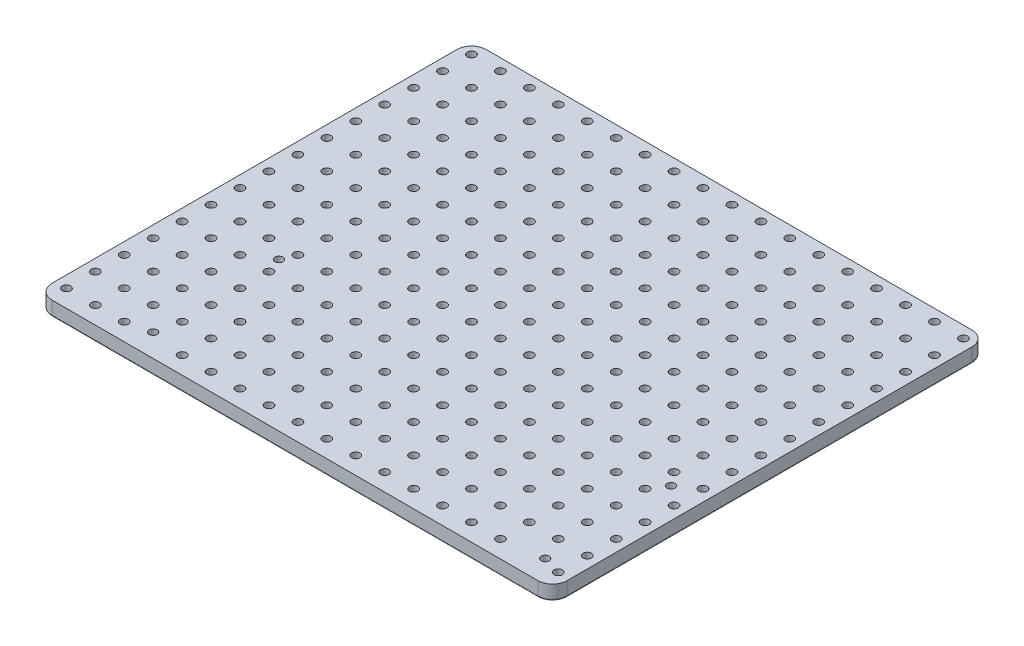
from build123d import *

# Parameters (mm, degrees)
SKETCH1_W            = 178
SKETCH1_H            = 150
BOSS_EXTRUDE1_DEPTH  = 5
SKETCH2_R            = 1.45
CUT_EXTRUDE1_DEPTH   = 233.828262889
LPATTERN1_COUNT      = 18
LPATTERN1_PITCH      = 10
LPATTERN1_COUNT_DIR2 = 15
LPATTERN1_PITCH_DIR2 = 10
SKETCH3_R            = 1.4
CUT_EXTRUDE2_DEPTH   = 233.828262889
FILLET1_R            = 5
FILLET2_R            = 0.5


with BuildPart() as part:
    # Sketch1 → Boss-Extrude1 (new body)
    with BuildSketch(Plane(origin=(0, 0, 0), x_dir=(1, 0, 0), z_dir=(0, 1, 0))):
        with Locations((89, 75)):
            Rectangle(SKETCH1_W, SKETCH1_H)
    extrude(amount=BOSS_EXTRUDE1_DEPTH)

    # Sketch2 → Cut-Extrude1 (cut, through all)
    with BuildSketch(Plane(origin=(0, 5, 0), x_dir=(1, 0, 0), z_dir=(0, 1, 0))):
        with Locations(Location((4, 146, 0), (0, 0, 270))):
            Circle(SKETCH2_R)
    cut_extrude1 = extrude(amount=-CUT_EXTRUDE1_DEPTH, mode=Mode.SUBTRACT)

    # LPattern1: Cut-Extrude1 18 × 15, 2 skipped
    with Locations(*[(i * LPATTERN1_PITCH, 0, j * LPATTERN1_PITCH_DIR2) for i in range(LPATTERN1_COUNT) for j in range(LPATTERN1_COUNT_DIR2) if (i, j) not in ((0, 0), (3, 14), (16, 14))]):
        add(cut_extrude1, mode=Mode.SUBTRACT)

    # Sketch3 → Cut-Extrude2 (cut, through all)
    with BuildSketch(Plane.XZ):
        with Locations(Location((32.088462575, -7.87577331, 0), (0, 0, 270))):
            Circle(SKETCH3_R)
        with Locations(Location((32.088462575, -51.37577267, 0), (0, 0, 270))):
            Circle(SKETCH3_R)
        with Locations(Location((167.588463355, -51.37577267, 0), (0, 0, 270))):
            Circle(SKETCH3_R)
        with Locations(Location((167.588463355, -7.87577331, 0), (0, 0, 270))):
            Circle(SKETCH3_R)
    extrude(amount=-CUT_EXTRUDE2_DEPTH, mode=Mode.SUBTRACT)

    # Fillet1
    fillet1_edges = [part.edges().sort_by_distance(p)[0] for p in [
        (0, 2.5, -150),
        (178, 2.5, -150),
        (178, 2.5, 0),
        (0, 2.5, 0),
    ]]
    fillet(fillet1_edges, radius=FILLET1_R)

    # Fillet2
    fillet2_edges = [part.edges().sort_by_distance(p)[0] for p in [
        (14, 0, -127.45),
        (24, 0, -127.45),
        (34, 0, -127.45),
        (44, 0, -127.45),
        (54, 0, -127.45),
        (64, 0, -127.45),
        (74, 0, -127.45),
        (84, 0, -127.45),
        (94, 0, -127.45),
        (104, 0, -127.45),
        (114, 0, -127.45),
        (124, 0, -127.45),
        (134, 0, -127.45),
        (144, 0, -127.45),
        (154, 0, -127.45),
        (164, 0, -127.45),
        (174, 0, -127.45),
        (4, 0, -117.45),
        (14, 0, -117.45),
        (24, 0, -117.45),
        (34, 0, -117.45),
        (44, 0, -117.45),
        (54, 0, -117.45),
        (64, 0, -117.45),
        (74, 0, -117.45),
        (84, 0, -117.45),
        (94, 0, -117.45),
        (104, 0, -117.45),
        (4, 0, -147.45),
        (114, 0, -117.45),
        (124, 0, -117.45),
        (134, 0, -117.45),
        (144, 0, -117.45),
        (154, 0, -117.45),
        (164, 0, -117.45),
        (174, 0, -117.45),
        (4, 0, -107.45),
        (14, 0, -107.45),
        (24, 0, -107.45),
        (34, 0, -107.45),
        (44, 0, -107.45),
        (54, 0, -107.45),
        (64, 0, -107.45),
        (74, 0, -107.45),
        (84, 0, -107.45),
        (94, 0, -107.45),
        (104, 0, -107.45),
        (114, 0, -107.45),
        (124, 0, -107.45),
        (134, 0, -107.45),
        (144, 0, -107.45),
        (154, 0, -107.45),
        (164, 0, -107.45),
        (174, 0, -107.45),
        (14, 0, -147.45),
        (4, 0, -97.45),
        (14, 0, -97.45),
        (24, 0, -97.45),
        (34, 0, -97.45),
        (44, 0, -97.45),
        (54, 0, -97.45),
        (64, 0, -97.45),
        (74, 0, -97.45),
        (84, 0, -97.45),
        (94, 0, -97.45),
        (104, 0, -97.45),
        (114, 0, -97.45),
        (124, 0, -97.45),
        (24, 0, -147.45),
        (134, 0, -97.45),
        (144, 0, -97.45),
        (154, 0, -97.45),
        (164, 0, -97.45),
        (174, 0, -97.45),
        (4, 0, -87.45),
        (14, 0, -87.45),
        (24, 0, -87.45),
        (34, 0, -87.45),
        (44, 0, -87.45),
        (34, 0, -147.45),
        (54, 0, -87.45),
        (64, 0, -87.45),
        (74, 0, -87.45),
        (84, 0, -87.45),
        (94, 0, -87.45),
        (104, 0, -87.45),
        (114, 0, -87.45),
        (124, 0, -87.45),
        (134, 0, -87.45),
        (144, 0, -87.45),
        (44, 0, -147.45),
        (154, 0, -87.45),
        (164, 0, -87.45),
        (174, 0, -87.45),
        (4, 0, -77.45),
        (14, 0, -77.45),
        (24, 0, -77.45),
        (34, 0, -77.45),
        (44, 0, -77.45),
        (54, 0, -77.45),
        (64, 0, -77.45),
        (54, 0, -147.45),
        (74, 0, -77.45),
        (84, 0, -77.45),
        (94, 0, -77.45),
        (104, 0, -77.45),
        (114, 0, -77.45),
        (124, 0, -77.45),
        (134, 0, -77.45),
        (144, 0, -77.45),
        (154, 0, -77.45),
        (164, 0, -77.45),
        (64, 0, -147.45),
        (174, 0, -77.45),
        (4, 0, -67.45),
        (14, 0, -67.45),
        (24, 0, -67.45),
        (34, 0, -67.45),
        (44, 0, -67.45),
        (54, 0, -67.45),
        (64, 0, -67.45),
        (74, 0, -67.45),
        (84, 0, -67.45),
        (74, 0, -147.45),
        (94, 0, -67.45),
        (104, 0, -67.45),
        (114, 0, -67.45),
        (124, 0, -67.45),
        (134, 0, -67.45),
        (144, 0, -67.45),
        (154, 0, -67.45),
        (164, 0, -67.45),
        (174, 0, -67.45),
        (4, 0, -57.45),
        (84, 0, -147.45),
        (14, 0, -57.45),
        (24, 0, -57.45),
        (34, 0, -57.45),
        (44, 0, -57.45),
        (54, 0, -57.45),
        (64, 0, -57.45),
        (74, 0, -57.45),
        (84, 0, -57.45),
        (94, 0, -57.45),
        (104, 0, -57.45),
        (94, 0, -147.45),
        (114, 0, -57.45),
        (124, 0, -57.45),
        (134, 0, -57.45),
        (144, 0, -57.45),
        (154, 0, -57.45),
        (164, 0, -57.45),
        (174, 0, -57.45),
        (4, 0, -47.45),
        (14, 0, -47.45),
        (24, 0, -47.45),
        (104, 0, -147.45),
        (34, 0, -47.45),
        (44, 0, -47.45),
        (54, 0, -47.45),
        (64, 0, -47.45),
        (74, 0, -47.45),
        (84, 0, -47.45),
        (94, 0, -47.45),
        (104, 0, -47.45),
        (114, 0, -47.45),
        (124, 0, -47.45),
        (114, 0, -147.45),
        (134, 0, -47.45),
        (144, 0, -47.45),
        (154, 0, -47.45),
        (164, 0, -47.45),
        (174, 0, -47.45),
        (4, 0, -37.45),
        (14, 0, -37.45),
        (24, 0, -37.45),
        (34, 0, -37.45),
        (44, 0, -37.45),
        (124, 0, -147.45),
        (54, 0, -37.45),
        (64, 0, -37.45),
        (74, 0, -37.45),
        (84, 0, -37.45),
        (94, 0, -37.45),
        (104, 0, -37.45),
        (114, 0, -37.45),
        (124, 0, -37.45),
        (134, 0, -37.45),
        (144, 0, -37.45),
        (134, 0, -147.45),
        (154, 0, -37.45),
        (164, 0, -37.45),
        (174, 0, -37.45),
        (4, 0, -27.45),
        (14, 0, -27.45),
        (24, 0, -27.45),
        (34, 0, -27.45),
        (44, 0, -27.45),
        (54, 0, -27.45),
        (64, 0, -27.45),
        (144, 0, -147.45),
        (74, 0, -27.45),
        (84, 0, -27.45),
        (94, 0, -27.45),
        (104, 0, -27.45),
        (114, 0, -27.45),
        (124, 0, -27.45),
        (134, 0, -27.45),
        (144, 0, -27.45),
        (154, 0, -27.45),
        (164, 0, -27.45),
        (154, 0, -147.45),
        (174, 0, -27.45),
        (4, 0, -17.45),
        (14, 0, -17.45),
        (24, 0, -17.45),
        (34, 0, -17.45),
        (44, 0, -17.45),
        (54, 0, -17.45),
        (64, 0, -17.45),
        (74, 0, -17.45),
        (84, 0, -17.45),
        (164, 0, -147.45),
        (94, 0, -17.45),
        (104, 0, -17.45),
        (114, 0, -17.45),
        (124, 0, -17.45),
        (134, 0, -17.45),
        (144, 0, -17.45),
        (154, 0, -17.45),
        (164, 0, -17.45),
        (174, 0, -17.45),
        (4, 0, -7.45),
        (174, 0, -147.45),
        (14, 0, -7.45),
        (24, 0, -7.45),
        (44, 0, -7.45),
        (54, 0, -7.45),
        (64, 0, -7.45),
        (74, 0, -7.45),
        (84, 0, -7.45),
        (94, 0, -7.45),
        (104, 0, -7.45),
        (114, 0, -7.45),
        (4, 0, -137.45),
        (124, 0, -7.45),
        (134, 0, -7.45),
        (144, 0, -7.45),
        (154, 0, -7.45),
        (174, 0, -7.45),
        (14, 0, -137.45),
        (24, 0, -137.45),
        (34, 0, -137.45),
        (44, 0, -137.45),
        (54, 0, -137.45),
        (167.588463355, 0, -6.47577331),
        (167.588463355, 0, -49.97577267),
        (32.088462575, 0, -49.97577267),
        (32.088462575, 0, -6.47577331),
        (64, 0, -137.45),
        (0, 0, -75),
        (89, 0, -150),
        (178, 0, -75),
        (89, 0, 0),
        (1.464466094, 0, -1.464466094),
        (176.535533906, 0, -1.464466094),
        (176.535533906, 0, -148.535533906),
        (1.464466094, 0, -148.535533906),
        (74, 0, -137.45),
        (84, 0, -137.45),
        (94, 0, -137.45),
        (104, 0, -137.45),
        (114, 0, -137.45),
        (124, 0, -137.45),
        (134, 0, -137.45),
        (144, 0, -137.45),
        (154, 0, -137.45),
        (164, 0, -137.45),
        (174, 0, -137.45),
        (4, 0, -127.45),
    ]]
    fillet(fillet2_edges, radius=FILLET2_R)


solid = part.part
